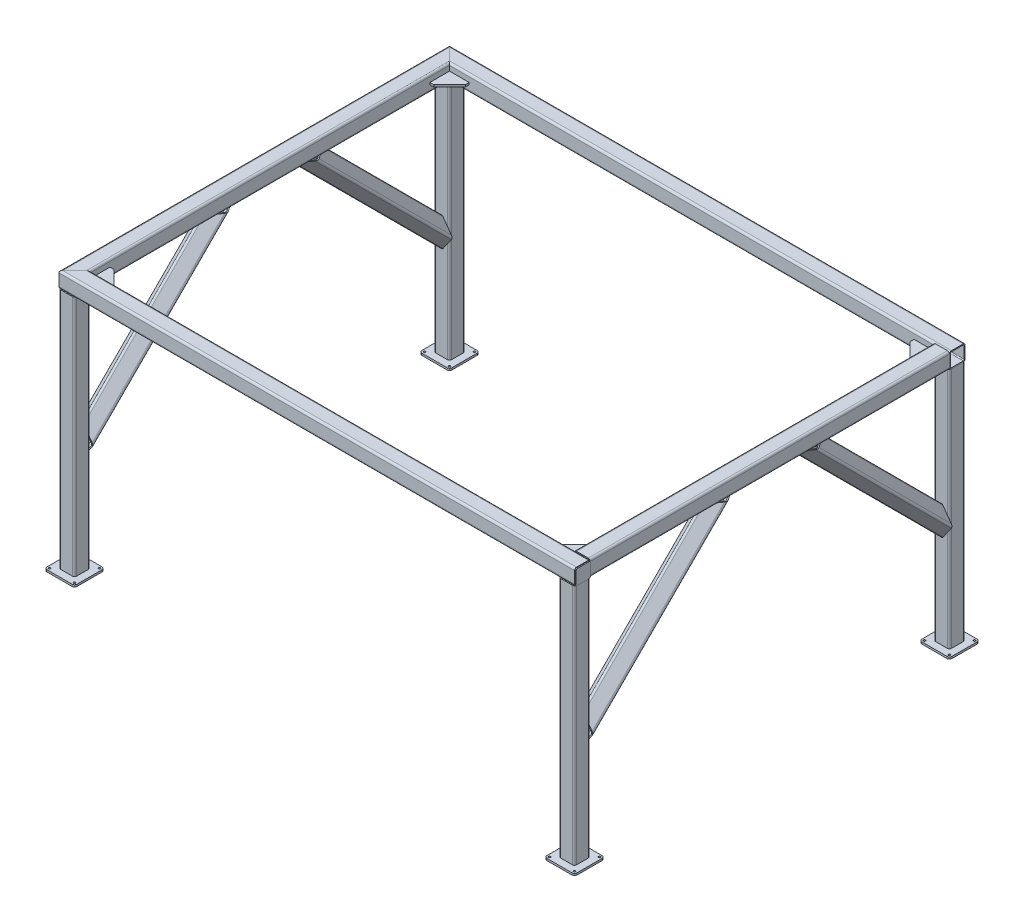
from build123d import *

# Parameters (mm, degrees)
SQUARE_START                                 = -1270
SQUARE_TUBE_CONFIGURED_80_X_80_X_5_2_DEPTH   = 1230
SQUARE_START_2                               = -1310
SQUARE_TUBE_CONFIGURED_80_X_80_X_5_2_2_DEPTH = 2620
SQUARE_START_3                               = -282
SQUARE_TUBE_CONFIGURED_80_X_80_X_5_4_W       = 117
SQUARE_TUBE_CONFIGURED_80_X_80_X_5_4_H       = 84
SQUARE_TUBE_CONFIGURED_80_X_80_X_5_2_3_DEPTH = 57.493596973
SQUARE_START_4                               = -992.5
SQUARE_TUBE_CONFIGURED_80_X_80_X_5_2_4_DEPTH = 1985
SQUARE_START_5                               = -224.506403027
SQUARE_TUBE_CONFIGURED_80_X_80_X_5_6_W       = 1405.493596973
SQUARE_TUBE_CONFIGURED_80_X_80_X_5_6_H       = 84
SQUARE_TUBE_CONFIGURED_80_X_80_X_5_2_5_DEPTH = 57.506403027
SQUARE_START_6                               = -1629
SQUARE_TUBE_CONFIGURED_80_X_80_X_5_7_W       = 58.506403027
SQUARE_TUBE_CONFIGURED_80_X_80_X_5_7_H       = 84
SQUARE_TUBE_CONFIGURED_80_X_80_X_5_2_6_DEPTH = 1404.493596973
SQUARE_START_7                               = -912.5
SQUARE_TUBE_CONFIGURED_80_X_80_X_5_2_7_DEPTH = 1825
SQUARE_TUBE_CONFIGURED_80_X_80_X_5_2_8_DEPTH = 2620
SQUARE_TUBE_CONFIGURED_80_X_80_X_5_10_W      = 117
SQUARE_TUBE_CONFIGURED_80_X_80_X_5_10_H      = 84
SQUARE_TUBE_CONFIGURED_80_X_80_X_5_2_9_DEPTH = 57.493596973
SQUARE_START_8                               = -1103.339626978
SQUARE_TUBE_CONFIGURED_80_X_80_X_5_2_1_DEPTH = 859.640835796
SQUARE_START_9                               = -1208.192440721
SQUARE_TUBE_CONFIGURED_80_X_80_X_5_12_DEPTH  = 1069.346463281
SQUARE_START_10                              = -40
SQUARE_TUBE_CONFIGURED_80_X_80_X_5_15_W      = 108
SQUARE_TUBE_CONFIGURED_80_X_80_X_5_15_H      = 757.5
SQUARE_TUBE_CONFIGURED_80_X_80_X_5_14_DEPTH  = 75
SQUARE_START_11                              = -797
SQUARE_TUBE_CONFIGURED_80_X_80_X_5_17_W      = 108
SQUARE_TUBE_CONFIGURED_80_X_80_X_5_17_H      = 75.5
SQUARE_TUBE_CONFIGURED_80_X_80_X_5_16_DEPTH  = 757
SKETCH3_R                                    = 5
BOSS_EXTRUDE1_DEPTH                          = 10
END_START                                    = 1310
END_CAP1_DEPTH                               = 5
GUSSET4_THICKNESS                            = 10


with BuildPart() as part:
    # Square tube - configured 80 X 80 X 5(2): read off the stored shape, not the designer's step
    # Square tube - configured 80 X 80 X 5(2) o → Square tube - configured 80 X 80 X 5(2) (new body)
    with BuildSketch(Plane(origin=(0, 0, 0), x_dir=(1, 0, 0), z_dir=(0, 1, 0)).offset(SQUARE_START)):
        with BuildLine():
            Line((-1300, 912.5), (-1240, 912.5))
            ThreePointArc((-1240, 912.5), (-1232.928932188, 915.428932188), (-1230, 922.5))
            Line((-1230, 922.5), (-1230, 982.5))
            ThreePointArc((-1230, 982.5), (-1232.928932188, 989.571067812), (-1240, 992.5))
            Line((-1240, 992.5), (-1300, 992.5))
            ThreePointArc((-1300, 992.5), (-1307.071067812, 989.571067812), (-1310, 982.5))
            Line((-1310, 982.5), (-1310, 922.5))
            ThreePointArc((-1310, 922.5), (-1307.071067812, 915.428932188), (-1300, 912.5))
        make_face()
        with BuildLine():
            ThreePointArc((-1300, 917.5), (-1303.535533906, 918.964466094), (-1305, 922.5))
            Line((-1305, 922.5), (-1305, 982.5))
            ThreePointArc((-1305, 982.5), (-1303.535533906, 986.035533906), (-1300, 987.5))
            Line((-1300, 987.5), (-1240, 987.5))
            ThreePointArc((-1240, 987.5), (-1236.464466094, 986.035533906), (-1235, 982.5))
            Line((-1235, 982.5), (-1235, 922.5))
            ThreePointArc((-1235, 922.5), (-1236.464466094, 918.964466094), (-1240, 917.5))
            Line((-1240, 917.5), (-1300, 917.5))
        make_face(mode=Mode.SUBTRACT)
    extrude(amount=SQUARE_TUBE_CONFIGURED_80_X_80_X_5_2_DEPTH)


with BuildPart() as body_2:
    # Square tube - configured 80 X 80 X 5 3 → Square tube - configured 80 X 80 X 5_2 2 (new body)
    with BuildSketch(Plane.YZ.offset(SQUARE_START_2)):
        with BuildLine():
            ThreePointArc((30, -992.5), (37.071067812, -989.571067812), (40, -982.5))
            Line((40, -982.5), (40, -922.5))
            ThreePointArc((40, -922.5), (37.071067812, -915.428932188), (30, -912.5))
            Line((30, -912.5), (-30, -912.5))
            ThreePointArc((-30, -912.5), (-37.071067812, -915.428932188), (-40, -922.5))
            Line((-40, -922.5), (-40, -982.5))
            ThreePointArc((-40, -982.5), (-37.071067812, -989.571067812), (-30, -992.5))
            Line((-30, -992.5), (30, -992.5))
        make_face()
        with BuildLine():
            Line((-30, -917.5), (30, -917.5))
            ThreePointArc((30, -917.5), (33.535533906, -918.964466094), (35, -922.5))
            Line((35, -922.5), (35, -982.5))
            ThreePointArc((35, -982.5), (33.535533906, -986.035533906), (30, -987.5))
            Line((30, -987.5), (-30, -987.5))
            ThreePointArc((-30, -987.5), (-33.535533906, -986.035533906), (-35, -982.5))
            Line((-35, -982.5), (-35, -922.5))
            ThreePointArc((-35, -922.5), (-33.535533906, -918.964466094), (-30, -917.5))
        make_face(mode=Mode.SUBTRACT)
    extrude(amount=SQUARE_TUBE_CONFIGURED_80_X_80_X_5_2_2_DEPTH)

    # Square tube - configured 80 X 80 X 5 4 → Square tube - configured 80 X 80 X 5_2 3 (cut)
    with BuildSketch(Plane(origin=(0, 0, 0), x_dir=(0.707106781186548, 0, 0.707106781186547), z_dir=(0.707106781186547, 0, -0.707106781186548)).offset(SQUARE_START_3)):
        with Locations((-1571.5, 0)):
            Rectangle(SQUARE_TUBE_CONFIGURED_80_X_80_X_5_4_W, SQUARE_TUBE_CONFIGURED_80_X_80_X_5_4_H)
    extrude(amount=SQUARE_TUBE_CONFIGURED_80_X_80_X_5_2_3_DEPTH, mode=Mode.SUBTRACT)


with BuildPart() as body_3:
    # Square tube - configured 80 X 80 X 5 5 → Square tube - configured 80 X 80 X 5_2 4 (new body)
    with BuildSketch(Plane.XY.offset(SQUARE_START_4)):
        with BuildLine():
            Line((-1240, 40), (-1300, 40))
            ThreePointArc((-1300, 40), (-1307.071067812, 37.071067812), (-1310, 30))
            Line((-1310, 30), (-1310, -30))
            ThreePointArc((-1310, -30), (-1307.071067812, -37.071067812), (-1300, -40))
            Line((-1300, -40), (-1240, -40))
            ThreePointArc((-1240, -40), (-1232.928932188, -37.071067812), (-1230, -30))
            Line((-1230, -30), (-1230, 30))
            ThreePointArc((-1230, 30), (-1232.928932188, 37.071067812), (-1240, 40))
        make_face()
        with BuildLine():
            ThreePointArc((-1240, 35), (-1236.464466094, 33.535533906), (-1235, 30))
            Line((-1235, 30), (-1235, -30))
            ThreePointArc((-1235, -30), (-1236.464466094, -33.535533906), (-1240, -35))
            Line((-1240, -35), (-1300, -35))
            ThreePointArc((-1300, -35), (-1303.535533906, -33.535533906), (-1305, -30))
            Line((-1305, -30), (-1305, 30))
            ThreePointArc((-1305, 30), (-1303.535533906, 33.535533906), (-1300, 35))
            Line((-1300, 35), (-1240, 35))
        make_face(mode=Mode.SUBTRACT)
    extrude(amount=SQUARE_TUBE_CONFIGURED_80_X_80_X_5_2_4_DEPTH)

    # Square tube - configured 80 X 80 X 5 6 → Square tube - configured 80 X 80 X 5_2 5 (cut)
    with BuildSketch(Plane(origin=(0, 0, 0), x_dir=(0.7071067811865471, 0, -0.707106781186548), z_dir=(0.707106781186548, 0, 0.707106781186547)).offset(SQUARE_START_5)):
        with Locations((-927.253201514, 0)):
            Rectangle(SQUARE_TUBE_CONFIGURED_80_X_80_X_5_6_W, SQUARE_TUBE_CONFIGURED_80_X_80_X_5_6_H)
    extrude(amount=SQUARE_TUBE_CONFIGURED_80_X_80_X_5_2_5_DEPTH, mode=Mode.SUBTRACT)

    # Square tube - configured 80 X 80 X 5 7 → Square tube - configured 80 X 80 X 5_2 6 (cut)
    with BuildSketch(Plane(origin=(0, 0, 0), x_dir=(0.7071067811865471, 0, -0.707106781186548), z_dir=(0.707106781186548, 0, 0.707106781186547)).offset(SQUARE_START_6)):
        with Locations((-195.253201514, 0)):
            Rectangle(SQUARE_TUBE_CONFIGURED_80_X_80_X_5_7_W, SQUARE_TUBE_CONFIGURED_80_X_80_X_5_7_H)
    extrude(amount=SQUARE_TUBE_CONFIGURED_80_X_80_X_5_2_6_DEPTH, mode=Mode.SUBTRACT)


with BuildPart() as body_4:
    # Square tube - configured 80 X 80 X 5 8 → Square tube - configured 80 X 80 X 5_2 7 (new body)
    with BuildSketch(Plane.XY.offset(SQUARE_START_7)):
        with BuildLine():
            ThreePointArc((1310, 30), (1307.071067812, 37.071067812), (1300, 40))
            Line((1300, 40), (1240, 40))
            ThreePointArc((1240, 40), (1232.928932188, 37.071067812), (1230, 30))
            Line((1230, 30), (1230, -30))
            ThreePointArc((1230, -30), (1232.928932188, -37.071067812), (1240, -40))
            Line((1240, -40), (1300, -40))
            ThreePointArc((1300, -40), (1307.071067812, -37.071067812), (1310, -30))
            Line((1310, -30), (1310, 30))
        make_face()
        with BuildLine():
            Line((1235, -30), (1235, 30))
            ThreePointArc((1235, 30), (1236.464466094, 33.535533906), (1240, 35))
            Line((1240, 35), (1300, 35))
            ThreePointArc((1300, 35), (1303.535533906, 33.535533906), (1305, 30))
            Line((1305, 30), (1305, -30))
            ThreePointArc((1305, -30), (1303.535533906, -33.535533906), (1300, -35))
            Line((1300, -35), (1240, -35))
            ThreePointArc((1240, -35), (1236.464466094, -33.535533906), (1235, -30))
        make_face(mode=Mode.SUBTRACT)
    extrude(amount=SQUARE_TUBE_CONFIGURED_80_X_80_X_5_2_7_DEPTH)


with BuildPart() as body_5:
    # Square tube - configured 80 X 80 X 5 9 → Square tube - configured 80 X 80 X 5_2 8 (new body)
    with BuildSketch(Plane.YZ.offset(SQUARE_START_2)):
        with BuildLine():
            Line((40, 922.5), (40, 982.5))
            ThreePointArc((40, 982.5), (37.071067812, 989.571067812), (30, 992.5))
            Line((30, 992.5), (-30, 992.5))
            ThreePointArc((-30, 992.5), (-37.071067812, 989.571067812), (-40, 982.5))
            Line((-40, 982.5), (-40, 922.5))
            ThreePointArc((-40, 922.5), (-37.071067812, 915.428932188), (-30, 912.5))
            Line((-30, 912.5), (30, 912.5))
            ThreePointArc((30, 912.5), (37.071067812, 915.428932188), (40, 922.5))
        make_face()
        with BuildLine():
            ThreePointArc((35, 922.5), (33.535533906, 918.964466094), (30, 917.5))
            Line((30, 917.5), (-30, 917.5))
            ThreePointArc((-30, 917.5), (-33.535533906, 918.964466094), (-35, 922.5))
            Line((-35, 922.5), (-35, 982.5))
            ThreePointArc((-35, 982.5), (-33.535533906, 986.035533906), (-30, 987.5))
            Line((-30, 987.5), (30, 987.5))
            ThreePointArc((30, 987.5), (33.535533906, 986.035533906), (35, 982.5))
            Line((35, 982.5), (35, 922.5))
        make_face(mode=Mode.SUBTRACT)
    extrude(amount=SQUARE_TUBE_CONFIGURED_80_X_80_X_5_2_8_DEPTH)

    # Square tube - configured 80 X 80 X 5 10 → Square tube - configured 80 X 80 X 5_2 9 (cut)
    with BuildSketch(Plane(origin=(0, 0, 0), x_dir=(0.7071067811865471, 0, -0.707106781186548), z_dir=(0.707106781186548, 0, 0.707106781186547)).offset(SQUARE_START_3)):
        with Locations((-1571.5, 0)):
            Rectangle(SQUARE_TUBE_CONFIGURED_80_X_80_X_5_10_W, SQUARE_TUBE_CONFIGURED_80_X_80_X_5_10_H)
    extrude(amount=SQUARE_TUBE_CONFIGURED_80_X_80_X_5_2_9_DEPTH, mode=Mode.SUBTRACT)


with BuildPart() as body_6:
    # Square tube - configured 80 X 80 X 5 11 → Square tube - configured 80 X 80 X 5_2 1 (new body)
    with BuildSketch(Plane(origin=(0, 0, 0), x_dir=(1, 0, 0), z_dir=(0, 0.707106781186546, 0.707106781186549)).offset(SQUARE_START_8)):
        with BuildLine():
            Line((-1319.497474683, 127.632774004), (-1277.071067812, 85.206367133))
            ThreePointArc((-1277.071067812, 85.206367133), (-1270, 82.277434945), (-1262.928932188, 85.206367133))
            Line((-1262.928932188, 85.206367133), (-1220.502525317, 127.632774004))
            ThreePointArc((-1220.502525317, 127.632774004), (-1217.573593129, 134.703841816), (-1220.502525317, 141.774909628))
            Line((-1220.502525317, 141.774909628), (-1262.928932188, 184.201316499))
            ThreePointArc((-1262.928932188, 184.201316499), (-1270, 187.130248687), (-1277.071067812, 184.201316499))
            Line((-1277.071067812, 184.201316499), (-1319.497474683, 141.774909628))
            ThreePointArc((-1319.497474683, 141.774909628), (-1322.426406871, 134.703841816), (-1319.497474683, 127.632774004))
        make_face()
        with BuildLine():
            ThreePointArc((-1266.464466094, 88.741901039), (-1270, 87.277434945), (-1273.535533906, 88.741901039))
            Line((-1273.535533906, 88.741901039), (-1315.961940777, 131.16830791))
            ThreePointArc((-1315.961940777, 131.16830791), (-1317.426406871, 134.703841816), (-1315.961940777, 138.239375722))
            Line((-1315.961940777, 138.239375722), (-1273.535533906, 180.665782593))
            ThreePointArc((-1273.535533906, 180.665782593), (-1270, 182.130248687), (-1266.464466094, 180.665782593))
            Line((-1266.464466094, 180.665782593), (-1224.038059223, 138.239375722))
            ThreePointArc((-1224.038059223, 138.239375722), (-1222.573593129, 134.703841816), (-1224.038059223, 131.16830791))
            Line((-1224.038059223, 131.16830791), (-1266.464466094, 88.741901039))
        make_face(mode=Mode.SUBTRACT)
    extrude(amount=SQUARE_TUBE_CONFIGURED_80_X_80_X_5_2_1_DEPTH)

    # Square tube - configured 80 X 80 X 5 13 → Square tube - configured 80 X 80 X 5 12 (add)
    with BuildSketch(Plane(origin=(0, 0, 0), x_dir=(1, 0, 0), z_dir=(0, 0.707106781186546, 0.707106781186549)).offset(SQUARE_START_9)):
        with BuildLine():
            Line((-1319.497474683, 127.632774004), (-1277.071067812, 85.206367133))
            ThreePointArc((-1277.071067812, 85.206367133), (-1270, 82.277434945), (-1262.928932188, 85.206367133))
            Line((-1262.928932188, 85.206367133), (-1220.502525317, 127.632774004))
            ThreePointArc((-1220.502525317, 127.632774004), (-1217.573593129, 134.703841816), (-1220.502525317, 141.774909628))
            Line((-1220.502525317, 141.774909628), (-1262.928932188, 184.201316499))
            ThreePointArc((-1262.928932188, 184.201316499), (-1270, 187.130248687), (-1277.071067812, 184.201316499))
            Line((-1277.071067812, 184.201316499), (-1319.497474683, 141.774909628))
            ThreePointArc((-1319.497474683, 141.774909628), (-1322.426406871, 134.703841816), (-1319.497474683, 127.632774004))
        make_face()
        with BuildLine():
            ThreePointArc((-1266.464466094, 88.741901039), (-1270, 87.277434945), (-1273.535533906, 88.741901039))
            Line((-1273.535533906, 88.741901039), (-1315.961940777, 131.16830791))
            ThreePointArc((-1315.961940777, 131.16830791), (-1317.426406871, 134.703841816), (-1315.961940777, 138.239375722))
            Line((-1315.961940777, 138.239375722), (-1273.535533906, 180.665782593))
            ThreePointArc((-1273.535533906, 180.665782593), (-1270, 182.130248687), (-1266.464466094, 180.665782593))
            Line((-1266.464466094, 180.665782593), (-1224.038059223, 138.239375722))
            ThreePointArc((-1224.038059223, 138.239375722), (-1222.573593129, 134.703841816), (-1224.038059223, 131.16830791))
            Line((-1224.038059223, 131.16830791), (-1266.464466094, 88.741901039))
        make_face(mode=Mode.SUBTRACT)
    extrude(amount=SQUARE_TUBE_CONFIGURED_80_X_80_X_5_12_DEPTH)

    # Square tube - configured 80 X 80 X 5 15 → Square tube - configured 80 X 80 X 5 14 (cut)
    with BuildSketch(Plane(origin=(0, 0, 0), x_dir=(1, 0, 0), z_dir=(0, 1, 0)).offset(SQUARE_START_10)):
        with Locations((-1270, 533.75)):
            Rectangle(SQUARE_TUBE_CONFIGURED_80_X_80_X_5_15_W, SQUARE_TUBE_CONFIGURED_80_X_80_X_5_15_H)
    extrude(amount=SQUARE_TUBE_CONFIGURED_80_X_80_X_5_14_DEPTH, mode=Mode.SUBTRACT)

    # Square tube - configured 80 X 80 X 5 17 → Square tube - configured 80 X 80 X 5 16 (cut)
    with BuildSketch(Plane(origin=(0, 0, 0), x_dir=(1, 0, 0), z_dir=(0, 1, 0)).offset(SQUARE_START_11)):
        with Locations((-1270, 950.25)):
            Rectangle(SQUARE_TUBE_CONFIGURED_80_X_80_X_5_17_W, SQUARE_TUBE_CONFIGURED_80_X_80_X_5_17_H)
    extrude(amount=SQUARE_TUBE_CONFIGURED_80_X_80_X_5_16_DEPTH, mode=Mode.SUBTRACT)


with BuildPart() as body_7:
    # Sketch3 → Boss-Extrude1 (new body)
    with BuildSketch(Plane.XZ.offset(1270)):
        with BuildLine():
            Line((-1333.5, -876.3), (-1206.5, -876.3))
            ThreePointArc((-1206.5, -876.3), (-1197.519743879, -880.019743879), (-1193.8, -889))
            Line((-1193.8, -889), (-1193.8, -1016))
            ThreePointArc((-1193.8, -1016), (-1197.519743879, -1024.980256121), (-1206.5, -1028.7))
            Line((-1206.5, -1028.7), (-1333.5, -1028.7))
            ThreePointArc((-1333.5, -1028.7), (-1342.480256121, -1024.980256121), (-1346.2, -1016))
            Line((-1346.2, -1016), (-1346.2, -889))
            ThreePointArc((-1346.2, -889), (-1342.480256121, -880.019743879), (-1333.5, -876.3))
        make_face()
        with Locations(Location((-1206.5, -889, 0), (0, 0, 270))):
            Circle(SKETCH3_R, mode=Mode.SUBTRACT)
        with Locations(Location((-1333.5, -889, 0), (0, 0, 90))):
            Circle(SKETCH3_R, mode=Mode.SUBTRACT)
        with Locations(Location((-1333.5, -1016, 0), (0, 0, 270))):
            Circle(SKETCH3_R, mode=Mode.SUBTRACT)
        with Locations(Location((-1206.5, -1016, 0), (0, 0, 90))):
            Circle(SKETCH3_R, mode=Mode.SUBTRACT)
    extrude(amount=BOSS_EXTRUDE1_DEPTH)


with BuildPart() as body_8:
    # End cap1: read off the stored shape, not the designer's step
    # End cap1 outline → End cap1 (new body)
    with BuildSketch(Plane.YZ.offset(END_START)):
        with BuildLine():
            Line((27.5, 990), (-27.5, 990))
            ThreePointArc((-27.5, 990), (-34.571067812, 987.071067812), (-37.5, 980))
            Line((-37.5, 980), (-37.5, 925))
            ThreePointArc((-37.5, 925), (-34.571067812, 917.928932188), (-27.5, 915))
            Line((-27.5, 915), (27.5, 915))
            ThreePointArc((27.5, 915), (34.571067812, 917.928932188), (37.5, 925))
            Line((37.5, 925), (37.5, 980))
            ThreePointArc((37.5, 980), (34.571067812, 987.071067812), (27.5, 990))
        make_face()
    extrude(amount=END_CAP1_DEPTH)


with BuildPart() as body_9:
    # Gusset4: a gusset: a plate 10.0 thick in the corner of two members, its outline drawn in place
    gusset4_outline = Wire([Line((-1230, 5, -912.5), (-1230, 5, -812.5)), Line((-1230, 5, -812.5), (-1210, 5, -812.5)), Line((-1210, 5, -812.5), (-1130, 5, -892.5)), Line((-1130, 5, -892.5), (-1130, 5, -912.5)), Line((-1130, 5, -912.5), (-1230, 5, -912.5))])
    add(extrude(Face(gusset4_outline), amount=GUSSET4_THICKNESS, dir=(0, -1, 0)))


with BuildPart() as body_10:
    # Mirror5: mirrored copy
    add(body_7.part.mirror(Plane.XY))


with BuildPart() as body_11:
    # Mirror5 2: mirrored copy
    add(part.part.mirror(Plane.XY))


with BuildPart() as body_12:
    # Mirror5 3: mirrored copy
    add(body_6.part.mirror(Plane.XY))


with BuildPart() as body_13:
    # Mirror5 4: mirrored copy
    add(body_9.part.mirror(Plane.XY))


with BuildPart() as body_14:
    # Mirror6: mirrored copy
    add(body_10.part.mirror(Plane(origin=(0, 0, 0), x_dir=(0, 0, 1), z_dir=(1, 0, 0))))


with BuildPart() as body_15:
    # Mirror6 2: mirrored copy
    add(body_11.part.mirror(Plane(origin=(0, 0, 0), x_dir=(0, 0, 1), z_dir=(1, 0, 0))))


with BuildPart() as body_16:
    # Mirror6 3: mirrored copy
    add(body_12.part.mirror(Plane(origin=(0, 0, 0), x_dir=(0, 0, 1), z_dir=(1, 0, 0))))


with BuildPart() as body_17:
    # Mirror6 4: mirrored copy
    add(body_13.part.mirror(Plane(origin=(0, 0, 0), x_dir=(0, 0, 1), z_dir=(1, 0, 0))))


with BuildPart() as body_18:
    # Mirror6 5: mirrored copy
    add(body_6.part.mirror(Plane(origin=(0, 0, 0), x_dir=(0, 0, 1), z_dir=(1, 0, 0))))


with BuildPart() as body_19:
    # Mirror6 6: mirrored copy
    add(part.part.mirror(Plane(origin=(0, 0, 0), x_dir=(0, 0, 1), z_dir=(1, 0, 0))))


with BuildPart() as body_20:
    # Mirror6 7: mirrored copy
    add(body_7.part.mirror(Plane(origin=(0, 0, 0), x_dir=(0, 0, 1), z_dir=(1, 0, 0))))


with BuildPart() as body_21:
    # Mirror6 8: mirrored copy
    add(body_9.part.mirror(Plane(origin=(0, 0, 0), x_dir=(0, 0, 1), z_dir=(1, 0, 0))))


solid = Compound([part.part, body_2.part, body_3.part, body_4.part, body_5.part, body_6.part, body_7.part, body_8.part, body_9.part, body_10.part, body_11.part, body_12.part, body_13.part, body_14.part, body_15.part, body_16.part, body_17.part, body_18.part, body_19.part, body_20.part, body_21.part])
